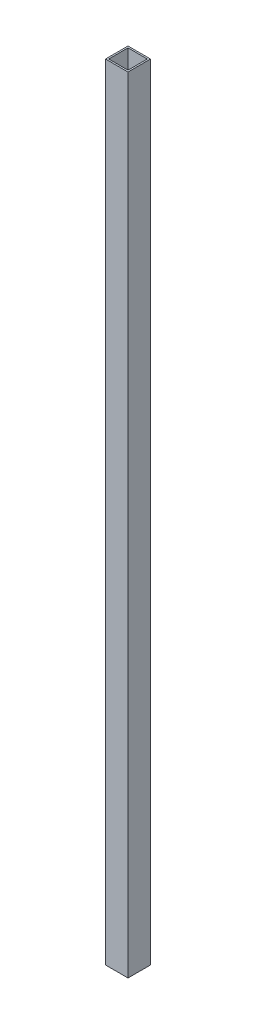
from build123d import *

# Parameters (mm, degrees)
SKETCH1_W           = 17
SKETCH1_H           = 17
SKETCH1_W_2         = 14.6
SKETCH1_H_2         = 14.6
BOSS_EXTRUDE1_DEPTH = 592.5


with BuildPart() as part:
    # Sketch1 → Boss-Extrude1 (new body)
    with BuildSketch(Plane(origin=(0, 0, 0), x_dir=(1, 0, 0), z_dir=(0, 1, 0))):
        Rectangle(SKETCH1_W, SKETCH1_H)
        Rectangle(SKETCH1_W_2, SKETCH1_H_2, mode=Mode.SUBTRACT)
    extrude(amount=BOSS_EXTRUDE1_DEPTH)


solid = part.part
